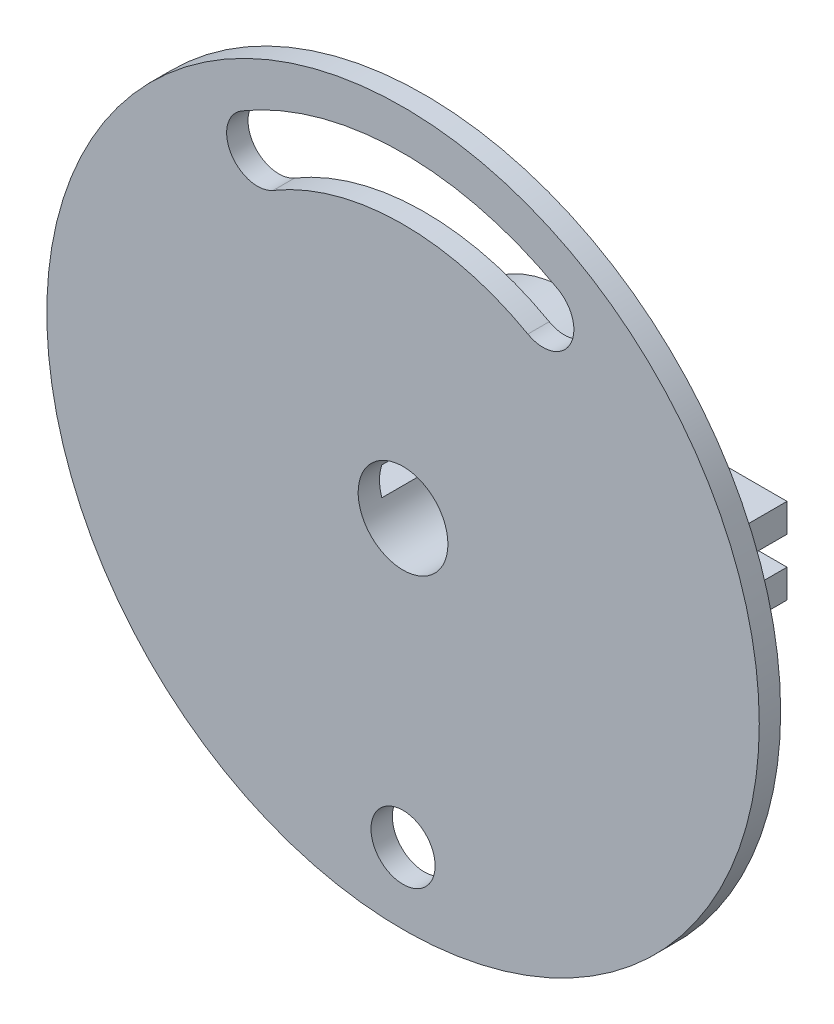
from build123d import *
from build123d.topology import SkipClean

# Parameters (mm, degrees)
SKETCH1_R           = 25
SKETCH1_R_2         = 2.25
BOSS_EXTRUDE1_DEPTH = 1.5
BOSS_EXTRUDE2_START = 10
BOSS_EXTRUDE2_DEPTH = 10
SKETCH4_R           = 1.1
CUT_EXTRUDE1_DEPTH  = 41.200162047


with BuildPart() as part:
    # Sketch1 → Boss-Extrude1 (new body)
    with BuildSketch(Plane.XY):
        with Locations((-2.056478496, 7.394811009)):
            Circle(SKETCH1_R)
        with Locations((-2.056478496, -12.605188991)):
            Circle(SKETCH1_R_2, mode=Mode.SUBTRACT)
        with BuildLine():
            ThreePointArc((-2.257963582, 25.260888974), (-6.874821844, 24.600069085), (-11.163369799, 22.76692436))
            ThreePointArc((-11.163369799, 22.76692436), (-14.132057019, 23.526738122), (-13.372243257, 26.495425342))
            ThreePointArc((-13.372243257, 26.495425342), (-8.066863393, 28.766644655), (-2.355342419, 29.593700179))
            ThreePointArc((-2.355342419, 29.593700179), (-2.305911076, 29.594310629), (-2.256478496, 29.594811009))
            ThreePointArc((-2.256478496, 29.594811009), (3.47218371, 28.89629687), (8.827256363, 26.744857922))
            ThreePointArc((8.827256363, 26.744857922), (9.653581953, 23.793992492), (6.702716524, 22.967666903))
            ThreePointArc((6.702716524, 22.967666903), (2.374062199, 24.70398913), (-2.256478496, 25.26090566))
            ThreePointArc((-2.256478496, 25.26090566), (-2.257221039, 25.260897332), (-2.257963582, 25.260888974))
        make_face(mode=Mode.SUBTRACT)
        with BuildLine():
            ThreePointArc((-3.662028612, 10.104923336), (-2.905892134, 10.428125446), (-2.09186952, 10.544612189))
            ThreePointArc((-2.09186952, 10.544612189), (0.158359904, 9.634675037), (1.093521504, 7.394811009))
            ThreePointArc((1.093521504, 7.394811009), (-3.616128638, 4.658026138), (-3.662028612, 10.104923336))
        make_face(mode=Mode.SUBTRACT)
    extrude(amount=BOSS_EXTRUDE1_DEPTH)

    # Sketch2 → Boss-Extrude2 (add)
    with SkipClean():  # the faces are left unmerged after this step: merging them gives an invalid solid
        with BuildSketch(Plane(origin=(0, 0, 0), x_dir=(-1, 0, 0), z_dir=(0, 0, -1)).offset(BOSS_EXTRUDE2_START)):
            with BuildLine():
                Line((-13.389247817, 10.394811009), (-5.521285026, 10.394811009))
                ThreePointArc((-5.521285026, 10.394811009), (2.056478496, 15.544811009), (9.634242018, 10.394811009))
                Line((9.634242018, 10.394811009), (17.882017751, 10.394811009))
                Line((17.882017751, 10.394811009), (17.882017751, 8.394811009))
                Line((17.882017751, 8.394811009), (5.043533902, 8.394811009))
                ThreePointArc((5.043533902, 8.394811009), (2.056478496, 10.544811009), (-0.93057691, 8.394811009))
                Line((-0.93057691, 8.394811009), (-6.031939149, 8.394811009))
                Line((-6.031939149, 8.394811009), (-13.389247817, 8.394811009))
                Line((-13.389247817, 8.394811009), (-13.389247817, 10.394811009))
            make_face()
            with BuildLine():
                Line((-13.389247817, 4.394811009), (-5.521285026, 4.394811009))
                ThreePointArc((-5.521285026, 4.394811009), (2.056478496, -0.755188991), (9.634242018, 4.394811009))
                Line((9.634242018, 4.394811009), (17.882017751, 4.394811009))
                Line((17.882017751, 4.394811009), (17.882017751, 6.394811009))
                Line((17.882017751, 6.394811009), (5.043533902, 6.394811009))
                ThreePointArc((5.043533902, 6.394811009), (2.056478496, 4.244811009), (-0.93057691, 6.394811009))
                Line((-0.93057691, 6.394811009), (-13.389247817, 6.394811009))
                Line((-13.389247817, 6.394811009), (-13.389247817, 4.394811009))
            make_face()
        extrude(amount=-BOSS_EXTRUDE2_DEPTH)

    # Sketch4 → Cut-Extrude1 (cut, through all)
    with SkipClean():  # the faces are left unmerged after this step: merging them gives an invalid solid
        with BuildSketch(Plane(origin=(0, 10.394811009, 0), x_dir=(1, 0, 0), z_dir=(0, 1, 0))):
            with Locations((9.264247817, 5)):
                Circle(SKETCH4_R)
            with Locations((-13.757017751, 5)):
                Circle(SKETCH4_R)
        extrude(amount=-CUT_EXTRUDE1_DEPTH, mode=Mode.SUBTRACT)


solid = part.part
